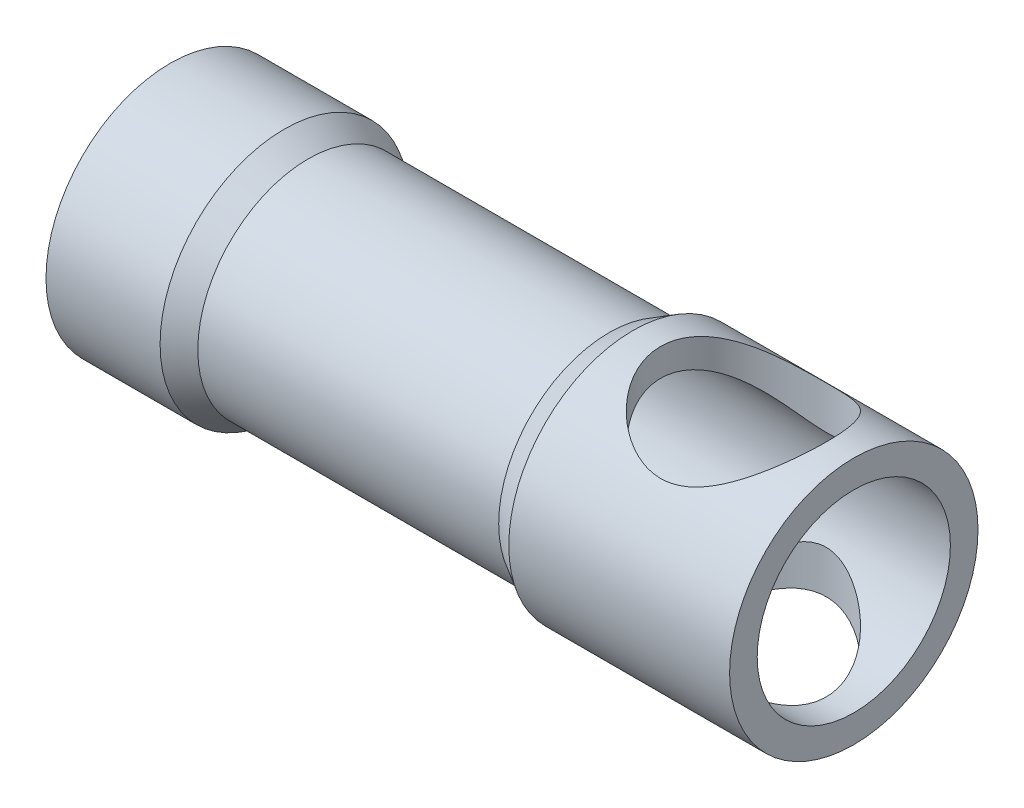
from build123d import *

# Parameters (mm, degrees)
THREAD1_PITCH      = 1.5
SKETCH4_R          = 9.525
CUT_EXTRUDE1_DEPTH = 25.4


with BuildPart() as part:
    # Sketch1 → Revolve1 (revolve)
    with BuildSketch(Plane.XY, mode=Mode.PRIVATE) as revolve1_sk:
        Polygon((0, 6), (0, 14.2875), (13.125369343, 14.2875), (15.875, 12.7), (50.488769343, 12.7), (53.2384, 14.2875), (78.6384, 14.2875), (78.6384, 11.1125), (15.875, 11.1125), (15.875, 6), align=None)
    revolve(revolve1_sk.sketch.rotate(Axis((0, 0, 0), (1, 0, 0)), 90), axis=Axis((0, 0, 0), (1, 0, 0)))

    # Thread1: the profile of Thread Profile1 profile screwed along a right-hand helix of 12.7 turns, 8 arcs to a turn; built about Z, then put on its axis
    thread1_z = Axis((0, 0, 0), (0, 0, 1))
    thread1_corners = [(5.9997, 0, -0.000173205), (6.811898812, 0, 0.468749998), (6.811898812, 0, 0.656249998), (5.9997, 0, 1.125173201)]
    with BuildLine(mode=Mode.PRIVATE) as thread1_profile:
        Line(thread1_corners[0], thread1_corners[1])
        Line(thread1_corners[1], thread1_corners[2])
        Line(thread1_corners[2], thread1_corners[3])
        Line(thread1_corners[3], thread1_corners[0])
    thread1_cap = Face(thread1_profile.wire())
    thread1_turn_angles = [0, 22.5, 45, 67.5, 90, 112.5, 135, 157.5, 180, 202.5, 225, 247.5, 270, 292.5, 315, 337.5, 360]
    thread1_turn_weights = [1, 0.9238795325112867, 1, 0.9238795325112867, 1, 0.9238795325112867, 1, 0.9238795325112867, 1, 0.9238795325112867, 1, 0.9238795325112867, 1, 0.9238795325112867, 1, 0.9238795325112867, 1]
    thread1_turn_rails = [Edge.make_bspline([Vector(p[0], p[1], 0).rotate(thread1_z, thread1_turn_angles[k]) / thread1_turn_weights[k] + Vector(0, 0, p[2] + THREAD1_PITCH * thread1_turn_angles[k] / 360) for k in range(17)], [0, 0, 0, 1, 1, 2, 2, 3, 3, 4, 4, 5, 5, 6, 6, 7, 7, 8, 8, 8], 2, thread1_turn_weights) for p in thread1_corners]
    thread1_turn_sides = [Face.make_surface_from_curves(thread1_turn_rails[p[0]], thread1_turn_rails[p[1]]) for p in [(0, 1), (1, 2), (2, 3), (3, 0)]]
    thread1_last_angles = [4320, 4342.5, 4365, 4387.5, 4410, 4432.5, 4455, 4477.5, 4500, 4522.5, 4545, 4558.5, 4572]
    thread1_last_weights = [1, 0.9238795325112867, 1, 0.9238795325112867, 1, 0.9238795325112867, 1, 0.9238795325112867, 1, 0.9238795325112867, 1, 0.9723699203976784, 1]
    thread1_last_rails = [Edge.make_bspline([Vector(p[0], p[1], 0).rotate(thread1_z, thread1_last_angles[k]) / thread1_last_weights[k] + Vector(0, 0, p[2] + THREAD1_PITCH * thread1_last_angles[k] / 360) for k in range(13)], [0, 0, 0, 1, 1, 2, 2, 3, 3, 4, 4, 5, 5, 6, 6, 6], 2, thread1_last_weights) for p in thread1_corners]
    thread1_last_sides = [Face.make_surface_from_curves(thread1_last_rails[p[0]], thread1_last_rails[p[1]]) for p in [(0, 1), (1, 2), (2, 3), (3, 0)]]
    thread1 = Plane(origin=(0, 0, 0), x_dir=(0, 0, -1), z_dir=(1, 0, 0)) * Solid(Shell([*[p.moved(Location((0, 0, THREAD1_PITCH * i))) for i in range(12) for p in thread1_turn_sides], *thread1_last_sides, thread1_cap, thread1_cap.rotate(thread1_z, 4572).moved(Location((0, 0, THREAD1_PITCH * 4572 / 360)))]))
    add(thread1, mode=Mode.SUBTRACT)

    # Sketch4 → Cut-Extrude1 (cut, symmetric)
    with BuildSketch(Plane(origin=(0, 0, 0), x_dir=(1, 0, 0), z_dir=(0, 1, 0))):
        with Locations(Location((65.9384, 0, 0), (0, 0, 270))):
            Circle(SKETCH4_R)
    extrude(amount=CUT_EXTRUDE1_DEPTH, both=True, mode=Mode.SUBTRACT)


solid = part.part
